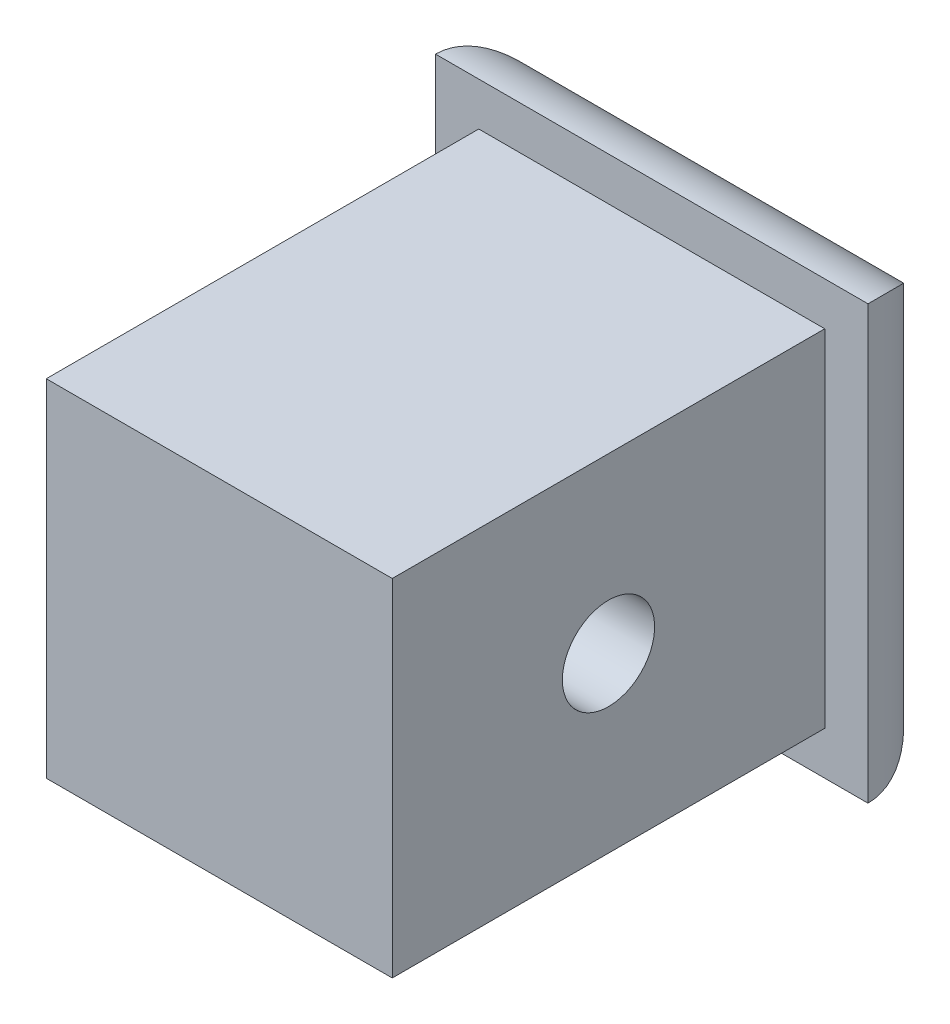
from build123d import *

# Parameters (mm, degrees)
SKETCH_8_W          = 15
SKETCH_8_H          = 15
EXTRUDE_3_DEPTH     = 3
SKETCH_9_W          = 12
SKETCH_9_H          = 12
EXTRUDE_4_DEPTH     = 15
SKETCH_10_R         = 1.6
CUT_EXTRUDE_2_DEPTH = 24.717082451
FILLET_2_R          = 3


with BuildPart() as part:
    # ｽｹｯﾁ8 → ﾎﾞｽ - 押し出し3 (new body)
    with BuildSketch(Plane.XY):
        Rectangle(SKETCH_8_W, SKETCH_8_H)
    extrude(amount=EXTRUDE_3_DEPTH)

    # ｽｹｯﾁ9 → ﾎﾞｽ - 押し出し4 (add)
    with BuildSketch(Plane.XY.offset(3)):
        Rectangle(SKETCH_9_W, SKETCH_9_H)
    extrude(amount=EXTRUDE_4_DEPTH)

    # ｽｹｯﾁ10 → ｶｯﾄ - 押し出し2 (cut, through all)
    with BuildSketch(Plane.ZY.offset(6)):
        with Locations((10.5, 0)):
            Circle(SKETCH_10_R)
    extrude(amount=-CUT_EXTRUDE_2_DEPTH, mode=Mode.SUBTRACT)

    # ﾌｨﾚｯﾄ2
    fillet_2_edges = [part.edges().sort_by_distance(p)[0] for p in [
        (0, 7.5, 0),
        (-7.5, 0, 0),
        (0, -7.5, 0),
        (7.5, 0, 0),
    ]]
    fillet(fillet_2_edges, radius=FILLET_2_R - 0.0001)  # a hair under: the kernel refuses the full size


solid = part.part
